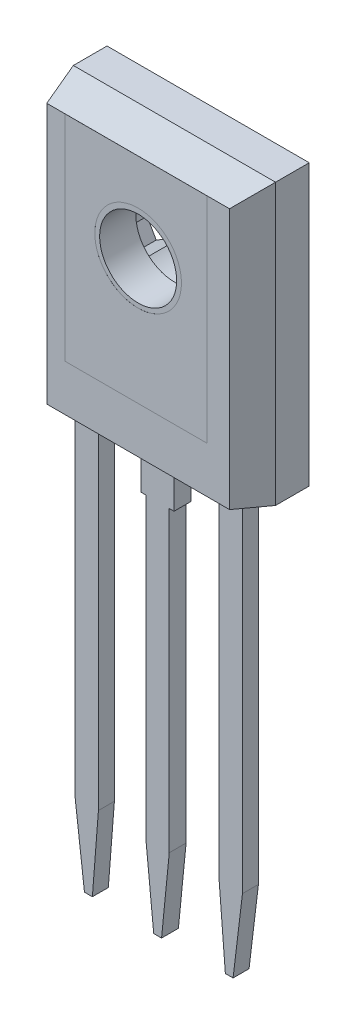
from build123d import *

# Parameters (mm, degrees)
SKETCH1_W                = 7.8
SKETCH1_H                = 10.8
SKETCH1_R                = 1.6
BOSS_EXTRUDE2_DEPTH      = 1.3
SKETCH3_W                = 7.8
SKETCH3_H                = 10.8
BOSS_EXTRUDE3_DEPTH      = 1.4
CUT_EXTRUDE2_DEPTH       = 2.5
CHAMFER2_SIZE            = 1.4
CHAMFER2_SIZE_2          = 0.375128869
SKETCH9_W                = 5.47205689
SKETCH9_H                = 8.265687236
BOSS_EXTRUDE7_DEPTH      = 0.001
SKETCH4_R                = 1.486166624
CUT_EXTRUDE3_DEPTH       = 4.4
BOSS_EXTRUDE4_DEPTH      = 1.5
BOSS_EXTRUDE4_DEPTH_BACK = 1.5
SKETCH5_W                = 1.27
SKETCH5_H                = 0.65
BOSS_EXTRUDE5_START      = -1.5
SKETCH7_W                = 0.9
SKETCH7_H                = 0.616281936
BOSS_EXTRUDE5_DEPTH      = 17.5
SKETCH10_R               = 1.671756862
CUT_EXTRUDE4_DEPTH       = 0.001
SKETCH12_W               = 0.9
SKETCH12_H               = 0.65
BOSS_EXTRUDE8_DEPTH      = 14.5
CUT_EXTRUDE6_DEPTH       = 15
CUT_EXTRUDE7_DEPTH       = 15
CUT_EXTRUDE8_DEPTH       = 15
SKETCH19_R               = 0.5
CUT_EXTRUDE10_DEPTH      = 0.1
CUT_EXTRUDE12_DEPTH      = 0.1
SKETCH21_W               = 0.230769231
SKETCH21_H               = 0.061538461
CUT_EXTRUDE13_DEPTH      = 0.1


with BuildPart() as part:
    # Sketch1 → Boss-Extrude2 (new body)
    with BuildSketch(Plane.XY):
        Rectangle(SKETCH1_W, SKETCH1_H)
        with Locations((0, 1.6)):
            Circle(SKETCH1_R, mode=Mode.SUBTRACT)
    extrude(amount=BOSS_EXTRUDE2_DEPTH)

    # Sketch2 → Cut-Extrude2 (cut)
    with BuildSketch(Plane.XY.offset(1.3)):
        Polygon((2.50166605, 0.733012702), (1.566244658, 1.273078494), (1.066244658, 0.40705309), (2.00166605, -0.133012702), (2.25166605, 0.3), align=None)
        Polygon((0, 4.2), (0.5, 4.2), (0.5, 3.119868415), (-0.5, 3.119868415), (-0.5, 4.2), align=None)
        Polygon((-2.00166605, -0.133012702), (-1.066244658, 0.40705309), (-1.566244658, 1.273078494), (-2.50166605, 0.733012702), (-2.25166605, 0.3), align=None)
    extrude(amount=-CUT_EXTRUDE2_DEPTH, mode=Mode.SUBTRACT)



with BuildPart() as body_2:
    # Sketch3 → Boss-Extrude3 (new body)
    with BuildSketch(Plane.XY.offset(1.3)):
        Rectangle(SKETCH3_W, SKETCH3_H)
    extrude(amount=BOSS_EXTRUDE3_DEPTH)

    # Chamfer2
    # the kernel refuses this chamfer: 1.4, 0.375128869 mm, written as the material it takes off along each edge
    with BuildSketch(Plane(origin=(7.535410198, 5.4, 2.7), x_dir=(0, 0.009967146577156156, -0.9999503267608394), z_dir=(-1, 0, 0)), Plane(origin=(-7.535410198, -5.4, 2.7), x_dir=(0, -0.009967146577156156, -0.9999503267608394), z_dir=(1, 0, 0))) as chamfer2_piece_1:
        Polygon((CHAMFER2_SIZE * 0.999950326761, CHAMFER2_SIZE * 0.00996714657716), (-CHAMFER2_SIZE_2 * 0.00996714658788, CHAMFER2_SIZE_2 * 0.999950327837), (0, 0), align=None)
    extrude(amount=15.070820397, mode=Mode.SUBTRACT)
    with BuildSketch(Plane(origin=(3.9, -9.035410198, 2.7), x_dir=(0.009967146577156461, 0, -0.9999503267608394), z_dir=(0, 1, 0)), Plane(origin=(-3.9, 9.035410198, 2.7), x_dir=(-0.009967146577156461, 0, -0.9999503267608394), z_dir=(0, -1, 0))) as chamfer2_piece_2:
        Polygon((CHAMFER2_SIZE * 0.999950326761, CHAMFER2_SIZE * 0.00996714657716), (-CHAMFER2_SIZE_2 * 0.00996714658788, CHAMFER2_SIZE_2 * 0.999950327837), (0, 0), align=None)
    extrude(amount=18.070820397, mode=Mode.SUBTRACT)

    # Sketch4 → Cut-Extrude3 (cut)
    with BuildSketch(Plane(origin=(0, 0, 1.3), x_dir=(-1, 0, 0), z_dir=(0, 0, -1))):
        with Locations((0, 1.6)):
            Circle(SKETCH4_R)
    extrude(amount=-CUT_EXTRUDE3_DEPTH, mode=Mode.SUBTRACT)


with BuildPart() as body_3:
    # Sketch9 → Boss-Extrude7 (new body)
    with BuildSketch(Plane.XY.offset(2.7)):
        with Locations((-0.07899218, 0.892027513)):
            Rectangle(SKETCH9_W, SKETCH9_H)
    extrude(amount=BOSS_EXTRUDE7_DEPTH)

    # Sketch10 → Cut-Extrude4 (cut)
    with BuildSketch(Plane.XY.offset(2.701)):
        with Locations((0, 1.615463385)):
            Circle(SKETCH10_R)
    extrude(amount=-CUT_EXTRUDE4_DEPTH, mode=Mode.SUBTRACT)


with BuildPart() as body_4:
    # Sketch5 → Boss-Extrude4 (new, two sides: drawn at the far end of the back side and taken through both)
    with BuildSketch(Plane.XZ.offset(5.4).offset(-BOSS_EXTRUDE4_DEPTH_BACK)):
        with Locations((0, 1.625)):
            Rectangle(SKETCH5_W, SKETCH5_H)
    extrude(amount=BOSS_EXTRUDE4_DEPTH + BOSS_EXTRUDE4_DEPTH_BACK)



with BuildPart() as part_1:
    add(part.part)

    add(body_2.part)  # Boss-Extrude5 merges body 2
    # Sketch7 → Boss-Extrude5 (add)
    with BuildSketch(Plane.XZ.offset(5.4).offset(BOSS_EXTRUDE5_START)):
        with Locations((-2.777989612, 1.596306683)):
            Rectangle(SKETCH7_W, SKETCH7_H)
    boss_extrude5 = extrude(amount=BOSS_EXTRUDE5_DEPTH)

    # Mirror1: Boss-Extrude5 across plane
    add(boss_extrude5.mirror(Plane(origin=(0, 0, 0), x_dir=(0, 0, 1), z_dir=(1, 0, 0))))


with BuildPart() as body_4_1:
    add(body_4.part)

    add(part_1.part)  # Boss-Extrude8 merges part
    # Sketch12 → Boss-Extrude8 (add)
    with BuildSketch(Plane.XZ.offset(6.9)):
        with Locations((0, 1.625)):
            Rectangle(SKETCH12_W, SKETCH12_H)
    extrude(amount=BOSS_EXTRUDE8_DEPTH)

    # Sketch13 → Cut-Extrude6 (cut)
    with BuildSketch(Plane.XY.offset(1.904447651)):
        Polygon((-2.327989612, -18.401297211), (-2.561302093, -21.4), (-2.327989612, -21.4), align=None)
        Polygon((-3.227989612, -21.4), (-2.865812834, -21.4), (-3.227989612, -18.401297211), align=None)
    extrude(amount=-CUT_EXTRUDE6_DEPTH, mode=Mode.SUBTRACT)

    # Sketch14 → Cut-Extrude7 (cut)
    with BuildSketch(Plane.XY.offset(1.95)):
        Polygon((0.45, -18.4), (0.15307153, -21.4), (0.45, -21.4), align=None)
        Polygon((-0.150188389, -21.4), (-0.45, -21.4), (-0.45, -18.4), align=None)
    extrude(amount=-CUT_EXTRUDE7_DEPTH, mode=Mode.SUBTRACT)

    # Sketch15 → Cut-Extrude8 (cut)
    with BuildSketch(Plane.XY.offset(1.904447651)):
        Polygon((2.569177225, -21.4), (2.327989612, -18.4), (2.327989612, -21.4), align=None)
        Polygon((3.227989612, -18.4), (2.865742943, -21.4), (3.227989612, -21.4), align=None)
    extrude(amount=-CUT_EXTRUDE8_DEPTH, mode=Mode.SUBTRACT)

    # Sketch19 → Cut-Extrude10 (cut)
    with BuildSketch(Plane(origin=(0, 0, 0), x_dir=(-1, 0, 0), z_dir=(0, 0, -1))):
        with Locations((2.415242459, 3.834109408)):
            Circle(SKETCH19_R)
        with Locations((-2.234159018, -1.213323665)):
            Circle(SKETCH19_R)
    extrude(amount=-CUT_EXTRUDE10_DEPTH, mode=Mode.SUBTRACT)

    # Sketch20 → Cut-Extrude12 (cut)
    # profile 1 of 2: a face of its own
    with BuildSketch(Plane(origin=(0, 0, 0), x_dir=(-1, 0, 0), z_dir=(0, 0, -1))):
        with BuildLine():
            Line((1.950403924, -2.501538497), (2.067471232, -2.501538497))
            add(Edge.make_bspline(
                [(2.067471232, -2.501538497), (2.073201828, -2.501568626), (2.08430915, -2.501627023), (2.100461054, -2.502532702), (2.115589422, -2.503767617), (2.12969864, -2.505727062), (2.142782189, -2.508091366), (2.154879498, -2.510954535), (2.165952099, -2.514387669), (2.179171425, -2.519847031), (2.194243539, -2.527959574), (2.210563263, -2.539947328), (2.224518276, -2.554610036), (2.236550216, -2.57114992), (2.246116122, -2.589344624), (2.253036573, -2.608760485), (2.257417923, -2.629147069), (2.257868512, -2.643143042), (2.258096232, -2.650216382)],
                knots=[0, 0, 0, 0, 1.001505555, 1.941167018, 2.826882275, 3.653841531, 4.429895133, 5.150066043, 5.825578002, 6.45369114, 7.647487171, 8.808567382, 9.977351308, 11.170798116, 12.373658725, 13.556498008, 14.765093433, 16, 16, 16, 16], degree=3))
            add(Edge.make_bspline(
                [(2.258096232, -2.650216382), (2.257908823, -2.656842534), (2.257540547, -2.669863549), (2.254018931, -2.688908253), (2.248505674, -2.707037033), (2.240841917, -2.724183728), (2.230881574, -2.739960919), (2.219077291, -2.754495879), (2.204835554, -2.767173203), (2.194165284, -2.774260558), (2.18874527, -2.777860613)],
                knots=[0, 0, 0, 0, 1.044552857, 2.05264487, 3.044412934, 4.028983338, 5.005914585, 5.980388656, 6.974128949, 8, 8, 8, 8], degree=3))
            add(Edge.make_bspline(
                [(2.18874527, -2.777860613), (2.195561344, -2.78047747), (2.20860218, -2.785484165), (2.226548354, -2.794335959), (2.242010327, -2.803963749), (2.255106981, -2.814477781), (2.266307722, -2.82581072), (2.276088226, -2.838128739), (2.284433605, -2.851592527), (2.291584391, -2.866061704), (2.297164178, -2.881388527), (2.301342905, -2.897429232), (2.303737324, -2.914126298), (2.304078063, -2.925489506), (2.304250078, -2.931225997)],
                knots=[0, 0, 0, 0, 1.27268992, 2.434971085, 3.483601985, 4.442670788, 5.356604649, 6.2567628, 7.179492994, 8.113709626, 9.066344395, 10.018646069, 10.999752585, 12, 12, 12, 12], degree=3))
            add(Edge.make_bspline(
                [(2.304250078, -2.931225997), (2.304082619, -2.937083175), (2.303753138, -2.948607337), (2.301322286, -2.965536789), (2.297206439, -2.981715351), (2.291537099, -2.997247668), (2.284137845, -3.012103691), (2.275133051, -3.026300251), (2.264396212, -3.039694708), (2.252385434, -3.0524359), (2.238797638, -3.063892092), (2.224137794, -3.074094785), (2.208221282, -3.082485538), (2.191309512, -3.089533999), (2.173212772, -3.09491809), (2.154012325, -3.098684817), (2.133724731, -3.101222824), (2.119803059, -3.101431487), (2.11266354, -3.101538497)],
                knots=[0, 0, 0, 0, 0.978564426, 1.925352924, 2.850884081, 3.763762016, 4.682927383, 5.618979971, 6.567305752, 7.547517671, 8.540179244, 9.531824382, 10.526200242, 11.540722885, 12.589160233, 13.674978461, 14.80764778, 16, 16, 16, 16], degree=3))
            Line((2.11266354, -3.101538497), (1.950403924, -3.101538497))
            Line((1.950403924, -3.101538497), (1.950403924, -2.501538497))
        make_face()
        with BuildLine():
            Line((2.004250078, -2.563076959), (2.004250078, -2.755384651))
            Line((2.004250078, -2.755384651), (2.040427963, -2.755384651))
            add(Edge.make_bspline(
                [(2.040427963, -2.755384651), (2.045716328, -2.755316093), (2.055934526, -2.755183624), (2.070732223, -2.754804164), (2.08446794, -2.753741643), (2.097117969, -2.752679426), (2.108662388, -2.750952354), (2.119075621, -2.748896562), (2.128521095, -2.746722349), (2.139413588, -2.743024723), (2.151768951, -2.737559979), (2.16494034, -2.729079092), (2.176551964, -2.718977775), (2.186357196, -2.707322181), (2.194382019, -2.694487978), (2.199955799, -2.680679941), (2.203735334, -2.666242205), (2.204076739, -2.656330504), (2.204250078, -2.651298113)],
                knots=[0, 0, 0, 0, 1.156816544, 2.235205308, 3.236616184, 4.169592532, 5.011045266, 5.787822928, 6.49130361, 7.128639758, 8.301311294, 9.436451833, 10.541879658, 11.654887649, 12.756523258, 13.837046038, 14.901820046, 16, 16, 16, 16], degree=3))
            add(Edge.make_bspline(
                [(2.204250078, -2.651298113), (2.204159876, -2.64796798), (2.203982934, -2.641435562), (2.202533796, -2.631912816), (2.200070784, -2.622956744), (2.196907191, -2.614444611), (2.192486273, -2.606642579), (2.187281107, -2.599280889), (2.180992132, -2.59261024), (2.173833735, -2.586375469), (2.165603686, -2.580847835), (2.156306893, -2.576006562), (2.145817577, -2.572108143), (2.134312516, -2.568693945), (2.121614615, -2.566295952), (2.107870406, -2.564298228), (2.092967311, -2.563281187), (2.082656722, -2.563146553), (2.077327001, -2.563076959)],
                knots=[0, 0, 0, 0, 0.91205012, 1.789085906, 2.630437955, 3.453916878, 4.269457761, 5.079663411, 5.91843418, 6.774407191, 7.675494373, 8.627863946, 9.638891023, 10.736472738, 11.911756761, 13.175263542, 14.539845004, 16, 16, 16, 16], degree=3))
            Line((2.077327001, -2.563076959), (2.004250078, -2.563076959))
        make_face(mode=Mode.SUBTRACT)
        with BuildLine():
            Line((2.004250078, -2.816923113), (2.004250078, -3.040000036))
            Line((2.004250078, -3.040000036), (2.08093277, -3.040000036))
            add(Edge.make_bspline(
                [(2.08093277, -3.040000036), (2.086421729, -3.03993425), (2.097000973, -3.039807458), (2.11227547, -3.039393534), (2.126432574, -3.038452001), (2.139407683, -3.036969856), (2.151340903, -3.035362122), (2.162089081, -3.033200188), (2.171739342, -3.030723223), (2.182929224, -3.026894508), (2.195529825, -3.020946541), (2.209108829, -3.011978388), (2.221181895, -3.001294393), (2.231434225, -2.988929093), (2.239836452, -2.975483723), (2.245948816, -2.961230234), (2.249718677, -2.946404144), (2.250175049, -2.936295565), (2.250403924, -2.931225997)],
                knots=[0, 0, 0, 0, 1.160039823, 2.235823828, 3.228722157, 4.157150951, 4.99529583, 5.772374946, 6.472645482, 7.099169577, 8.269452708, 9.405989375, 10.527446681, 11.663510218, 12.788923519, 13.866172445, 14.929861265, 16, 16, 16, 16], degree=3))
            add(Edge.make_bspline(
                [(2.250403924, -2.931225997), (2.250356592, -2.92805571), (2.250262691, -2.921766273), (2.248846586, -2.912523562), (2.246787065, -2.903570555), (2.244124534, -2.894882942), (2.240246911, -2.886617792), (2.235720075, -2.878611639), (2.230412406, -2.870853899), (2.222141977, -2.861046085), (2.210112494, -2.849746025), (2.193019904, -2.838682453), (2.173584653, -2.829759972), (2.159488511, -2.825971491), (2.152206809, -2.824014459)],
                knots=[0, 0, 0, 0, 0.723448775, 1.435228256, 2.130040452, 2.821711965, 3.505591119, 4.210454504, 4.921174351, 5.648778258, 7.137944449, 8.670945889, 10.280296675, 12, 12, 12, 12], degree=3))
            add(Edge.make_bspline(
                [(2.152206809, -2.824014459), (2.149287535, -2.823422159), (2.142957948, -2.82213793), (2.132636649, -2.820782324), (2.120853357, -2.819574599), (2.107580863, -2.818681258), (2.092802376, -2.81775785), (2.076486333, -2.817398738), (2.058699365, -2.816970294), (2.046357815, -2.816939242), (2.039947193, -2.816923113)],
                knots=[0, 0, 0, 0, 0.634451884, 1.375622551, 2.216452059, 3.157844607, 4.20941857, 5.370758133, 6.634282058, 8, 8, 8, 8], degree=3))
            Line((2.039947193, -2.816923113), (2.004250078, -2.816923113))
        make_face(mode=Mode.SUBTRACT)
    # profile 2 of 2: a face of its own
    with BuildSketch(Plane(origin=(0, 0, 0), x_dir=(-1, 0, 0), z_dir=(0, 0, -1))):
        with BuildLine():
            Line((2.427327001, -3.101538497), (2.427327001, -2.501538497))
            Line((2.427327001, -2.501538497), (2.548480847, -2.501538497))
            add(Edge.make_bspline(
                [(2.548480847, -2.501538497), (2.559018388, -2.501614366), (2.579376862, -2.501760945), (2.608796139, -2.502690327), (2.636016212, -2.504334406), (2.66094756, -2.506729182), (2.683658625, -2.509669702), (2.704085815, -2.513355486), (2.722334753, -2.517707744), (2.733558086, -2.521418392), (2.738865463, -2.523173113)],
                knots=[0, 0, 0, 0, 1.314313732, 2.53924729, 3.670748893, 4.714932338, 5.66265055, 6.526160246, 7.303039223, 8, 8, 8, 8], degree=3))
            add(Edge.make_bspline(
                [(2.738865463, -2.523173113), (2.745807418, -2.525818377), (2.759533908, -2.531048918), (2.779077986, -2.540915713), (2.79747662, -2.552095102), (2.814828473, -2.564601821), (2.830737186, -2.578789995), (2.845824254, -2.594056924), (2.859472493, -2.610957782), (2.871971058, -2.629142066), (2.883240028, -2.648395561), (2.893035312, -2.668681579), (2.901170283, -2.689897101), (2.907923407, -2.711983126), (2.913245657, -2.734988219), (2.916876845, -2.758939168), (2.919271872, -2.783741315), (2.919512567, -2.800571223), (2.919634693, -2.809110613)],
                knots=[0, 0, 0, 0, 0.984719456, 1.947108742, 2.898477687, 3.838006223, 4.779231079, 5.722358779, 6.681677486, 7.655904652, 8.64651281, 9.637519902, 10.640069247, 11.656948941, 12.698408672, 13.768548281, 14.867775369, 16, 16, 16, 16], degree=3))
            add(Edge.make_bspline(
                [(2.919634693, -2.809110613), (2.91952687, -2.816526825), (2.919314394, -2.831141246), (2.917406511, -2.852679685), (2.914633428, -2.873579155), (2.910340137, -2.893740132), (2.905128277, -2.913339255), (2.898448709, -2.93216764), (2.890796909, -2.950398007), (2.881874073, -2.96778386), (2.872078407, -2.984255295), (2.861566108, -2.999782529), (2.850348389, -3.014143995), (2.83831828, -3.027383186), (2.825631243, -3.039480142), (2.812204215, -3.050535916), (2.798002549, -3.060334183), (2.783089854, -3.069259973), (2.767031089, -3.077046319), (2.749522083, -3.083634321), (2.730488167, -3.089093741), (2.70997606, -3.093648751), (2.687950321, -3.097262003), (2.664389356, -3.099683671), (2.639329363, -3.101321316), (2.622121489, -3.101464698), (2.613264501, -3.101538497)],
                knots=[0, 0, 0, 0, 1.105936401, 2.179363191, 3.223086493, 4.248585256, 5.251745608, 6.245858792, 7.225916811, 8.198733463, 9.158002045, 10.082870192, 10.993790845, 11.873723703, 12.748670949, 13.606408763, 14.465103618, 15.319838547, 16.196477973, 17.123216899, 18.106603292, 19.147568657, 20.255746949, 21.433717677, 22.679120308, 24, 24, 24, 24], degree=3))
            Line((2.613264501, -3.101538497), (2.427327001, -3.101538497))
        make_face()
        with BuildLine():
            Line((2.481173155, -3.040000036), (2.550043347, -3.040000036))
            add(Edge.make_bspline(
                [(2.550043347, -3.040000036), (2.559939639, -3.039957505), (2.578973833, -3.039875703), (2.606343776, -3.039157896), (2.631351672, -3.037984993), (2.654001074, -3.036343551), (2.674279192, -3.034171788), (2.692228407, -3.031750376), (2.70778988, -3.028733671), (2.717206354, -3.02599922), (2.72155777, -3.024735613)],
                knots=[0, 0, 0, 0, 1.375205317, 2.645023457, 3.804390687, 4.853969522, 5.800190428, 6.637939096, 7.370582563, 8, 8, 8, 8], degree=3))
            add(Edge.make_bspline(
                [(2.72155777, -3.024735613), (2.727034632, -3.022806774), (2.737857542, -3.018995167), (2.753437156, -3.012042425), (2.767966929, -3.003806642), (2.781700076, -2.994651966), (2.794441788, -2.984255509), (2.806343065, -2.972843339), (2.817379946, -2.960357378), (2.827438398, -2.946813122), (2.836439822, -2.932294871), (2.84423489, -2.916945357), (2.851066581, -2.900932761), (2.856428625, -2.884011191), (2.860631297, -2.866331923), (2.863608101, -2.847893715), (2.865462053, -2.82870001), (2.865678302, -2.81564536), (2.86578854, -2.80899042)],
                knots=[0, 0, 0, 0, 0.998632004, 1.973411704, 2.929992603, 3.868527914, 4.809262121, 5.754881198, 6.702106254, 7.672490631, 8.653608572, 9.636854334, 10.631411391, 11.644891563, 12.686317036, 13.754757253, 14.855430412, 16, 16, 16, 16], degree=3))
            add(Edge.make_bspline(
                [(2.86578854, -2.80899042), (2.865700548, -2.801973252), (2.865527686, -2.788187964), (2.863354947, -2.767960987), (2.860179823, -2.748507161), (2.855588334, -2.729825185), (2.849737327, -2.71187861), (2.842435388, -2.694766694), (2.834092539, -2.678308717), (2.824166253, -2.66288454), (2.813295008, -2.64829715), (2.801230229, -2.63493345), (2.788163594, -2.622762998), (2.774237619, -2.611596259), (2.759059831, -2.601882486), (2.74298777, -2.593193341), (2.725785655, -2.585819188), (2.713817764, -2.581897097), (2.707735655, -2.579903882)],
                knots=[0, 0, 0, 0, 1.122418816, 2.205001699, 3.251619955, 4.274784885, 5.280384055, 6.268708349, 7.249350384, 8.229342522, 9.199999885, 10.157847722, 11.105861043, 12.055065948, 13.010012805, 13.98527497, 14.976112212, 16, 16, 16, 16], degree=3))
            add(Edge.make_bspline(
                [(2.707735655, -2.579903882), (2.70270403, -2.578512494), (2.692005414, -2.575554022), (2.674547221, -2.572326816), (2.654898909, -2.56948033), (2.632973246, -2.567070381), (2.608795225, -2.565341125), (2.58234625, -2.564043186), (2.553614889, -2.563167763), (2.533697883, -2.563107985), (2.523360655, -2.563076959)],
                knots=[0, 0, 0, 0, 0.674548936, 1.434276114, 2.292660221, 3.240891867, 4.284742987, 5.42552168, 6.663806718, 8, 8, 8, 8], degree=3))
            Line((2.523360655, -2.563076959), (2.481173155, -2.563076959))
            Line((2.481173155, -2.563076959), (2.481173155, -3.040000036))
        make_face(mode=Mode.SUBTRACT)
    extrude(amount=-CUT_EXTRUDE12_DEPTH, mode=Mode.SUBTRACT)

    # Sketch21 → Cut-Extrude13 (cut)
    # profile 1 of 6: a face of its own
    with BuildSketch(Plane(origin=(0, 0, 0), x_dir=(-1, 0, 0), z_dir=(0, 0, -1))):
        Polygon((-0.025656151, -3.428685515), (0.085281349, -3.428685515), (0.085281349, -4.028685515), (0.031435195, -4.028685515), (0.031435195, -3.490223977), (-0.060872497, -3.490223977), align=None)
    # profile 2 of 6: a face of its own
    with BuildSketch(Plane(origin=(0, 0, 0), x_dir=(-1, 0, 0), z_dir=(0, 0, -1))):
        Polygon((0.635882311, -3.4133009), (0.646819811, -3.4133009), (0.646819811, -3.828685515), (0.71605058, -3.828685515), (0.71605058, -3.890223977), (0.646819811, -3.890223977), (0.646819811, -4.028685515), (0.592973657, -4.028685515), (0.592973657, -3.890223977), (0.308358272, -3.890223977), align=None)
        Polygon((0.592973657, -3.828685515), (0.592973657, -3.568108592), (0.414127503, -3.828685515), align=None, mode=Mode.SUBTRACT)
    # profile 3 of 6: a face of its own
    with BuildSketch(Plane(origin=(0, 0, 0), x_dir=(-1, 0, 0), z_dir=(0, 0, -1))):
        with BuildLine():
            add(Edge.make_bspline(
                [(0.769896734, -3.7289259), (0.769952965, -3.719309205), (0.770062196, -3.700628636), (0.771277354, -3.673408412), (0.773295984, -3.647872362), (0.776062391, -3.624019265), (0.779428902, -3.601842963), (0.783922985, -3.581402718), (0.789033752, -3.562603929), (0.794957028, -3.545385292), (0.801640649, -3.529514829), (0.808915094, -3.51469908), (0.817069058, -3.500960463), (0.825636529, -3.488079699), (0.834964313, -3.476267637), (0.844786963, -3.465357466), (0.855487856, -3.455601337), (0.866703229, -3.4467134), (0.878534622, -3.438922062), (0.890644794, -3.432059307), (0.903117098, -3.426196472), (0.915985586, -3.421586683), (0.929134596, -3.417779109), (0.942610093, -3.41517529), (0.956434327, -3.413536963), (0.96576543, -3.413380334), (0.970497695, -3.4133009)],
                knots=[0, 0, 0, 0, 1.646270934, 3.197905019, 4.663502075, 6.030701355, 7.308322542, 8.50163776, 9.611534131, 10.641858119, 11.616356847, 12.558055219, 13.465016945, 14.349605745, 15.204443733, 16.039544428, 16.859896111, 17.680448484, 18.487036065, 19.28249412, 20.06191084, 20.843045899, 21.620316918, 22.403196591, 23.190181807, 24, 24, 24, 24], degree=3))
            add(Edge.make_bspline(
                [(0.970497695, -3.4133009), (0.975269492, -3.413384525), (0.984759093, -3.41355083), (0.998788872, -3.41514922), (1.012494531, -3.417801413), (1.025817641, -3.421559294), (1.038867639, -3.42622141), (1.051542451, -3.432064916), (1.063920808, -3.438867007), (1.075806, -3.446859672), (1.087328506, -3.455770919), (1.098205299, -3.46584452), (1.108437371, -3.476978757), (1.118153138, -3.489054505), (1.127076955, -3.502303377), (1.135575257, -3.516494939), (1.143181892, -3.531877373), (1.150507836, -3.548194024), (1.15683132, -3.565896366), (1.162534105, -3.584884611), (1.167141928, -3.605383043), (1.170980089, -3.627284113), (1.1739535, -3.650668253), (1.176119095, -3.675485336), (1.177263053, -3.701751688), (1.177478487, -3.719710177), (1.177589041, -3.7289259)],
                knots=[0, 0, 0, 0, 0.810914788, 1.612654377, 2.396697861, 3.181598691, 3.963628158, 4.749916497, 5.551656086, 6.361998678, 7.18212741, 8.025565596, 8.878627764, 9.750805457, 10.657531673, 11.591944965, 12.560506719, 13.57287815, 14.630710178, 15.753379473, 16.941251878, 18.199788006, 19.531962791, 20.947069417, 22.433333509, 24, 24, 24, 24], degree=3))
            add(Edge.make_bspline(
                [(1.177589041, -3.7289259), (1.177477341, -3.738101427), (1.177259698, -3.755979567), (1.17613192, -3.782127734), (1.17391044, -3.806813113), (1.171131585, -3.830094907), (1.167282848, -3.851876213), (1.162550534, -3.872232404), (1.157296193, -3.891251388), (1.150810228, -3.908777355), (1.143711249, -3.925054794), (1.135987502, -3.940254876), (1.127712674, -3.954511955), (1.118697461, -3.967711912), (1.109088304, -3.979948253), (1.09867954, -3.991004988), (1.087764583, -4.001148532), (1.076208169, -4.010174525), (1.064137617, -4.018074777), (1.051801775, -4.025140009), (1.038981767, -4.030837042), (1.025968118, -4.035728764), (1.012574684, -4.039465984), (0.99881816, -4.042050073), (0.984768519, -4.04386239), (0.975271108, -4.044000644), (0.970497695, -4.044070131)],
                knots=[0, 0, 0, 0, 1.561518951, 3.042555995, 4.452378317, 5.7783523, 7.031515105, 8.214008947, 9.334062868, 10.386615937, 11.391082383, 12.354592575, 13.286541444, 14.194233754, 15.072674879, 15.931287219, 16.775624067, 17.606195743, 18.42308326, 19.229000347, 20.022332153, 20.807536673, 21.593273796, 22.3848459, 23.188221202, 24, 24, 24, 24], degree=3))
            add(Edge.make_bspline(
                [(0.970497695, -4.044070131), (0.965765561, -4.043990184), (0.956434717, -4.043832545), (0.942608587, -4.042201619), (0.92918874, -4.039579533), (0.916108953, -4.035908115), (0.903302122, -4.031414143), (0.890942759, -4.025559226), (0.878893441, -4.018816243), (0.867186318, -4.011137028), (0.856041376, -4.002339025), (0.845395901, -3.992608004), (0.835517326, -3.981701133), (0.826322909, -3.969790632), (0.817584494, -3.956986077), (0.809546316, -3.943112641), (0.802111312, -3.928225336), (0.795315285, -3.91222798), (0.7892898, -3.894887136), (0.783967336, -3.876004419), (0.779764909, -3.855413167), (0.776167831, -3.833278762), (0.773266508, -3.809506088), (0.771285767, -3.78408224), (0.770061541, -3.757023061), (0.769952672, -3.738462529), (0.769896734, -3.7289259)],
                knots=[0, 0, 0, 0, 0.810891512, 1.598919785, 2.382837074, 3.152667961, 3.926044502, 4.706494248, 5.493654104, 6.291793342, 7.103789334, 7.925228297, 8.761435821, 9.622817696, 10.50288917, 11.416980706, 12.369136599, 13.353924996, 14.394355917, 15.514179734, 16.714354668, 17.994756427, 19.357759367, 20.818452758, 22.365282078, 24, 24, 24, 24], degree=3))
        make_face()
        with BuildLine():
            add(Edge.make_bspline(
                [(0.823742888, -3.728685515), (0.823763364, -3.736699578), (0.823803105, -3.7522533), (0.824841311, -3.774855002), (0.826255637, -3.795935629), (0.828079859, -3.81552195), (0.830788936, -3.833547666), (0.833824385, -3.850136755), (0.837518343, -3.865201424), (0.841888918, -3.878845049), (0.846867049, -3.891299175), (0.85230234, -3.902887955), (0.858141321, -3.913748287), (0.864676032, -3.923782619), (0.8717929, -3.933023676), (0.879331173, -3.941635019), (0.887572188, -3.949314501), (0.898972829, -3.958524819), (0.914023654, -3.968042385), (0.93298716, -3.976330286), (0.95247318, -3.981538707), (0.965699109, -3.982201065), (0.97230058, -3.982531669)],
                knots=[0, 0, 0, 0, 1.459021318, 2.831673884, 4.118529203, 5.306027144, 6.411944654, 7.436330062, 8.375795394, 9.233974572, 10.042671642, 10.816086306, 11.563610507, 12.285937304, 12.993564865, 13.685989202, 14.367179055, 15.041617293, 16.353048772, 17.594441528, 18.799311195, 20, 20, 20, 20], degree=3))
            add(Edge.make_bspline(
                [(0.97230058, -3.982531669), (0.978944752, -3.982257764), (0.992219379, -3.981710519), (1.011613744, -3.976430735), (1.03044179, -3.968464528), (1.04519698, -3.959044956), (1.056422559, -3.950074385), (1.064465471, -3.94242616), (1.071847537, -3.933862297), (1.078849035, -3.924622418), (1.085270591, -3.914529992), (1.091109986, -3.90363355), (1.09643856, -3.891902834), (1.099474397, -3.883713736), (1.101026541, -3.879526861)],
                knots=[0, 0, 0, 0, 1.353760809, 2.704726607, 4.075137775, 5.516104923, 6.260822281, 7.007110065, 7.778089737, 8.566572457, 9.372053459, 10.217411131, 11.088608312, 12, 12, 12, 12], degree=3))
            add(Edge.make_bspline(
                [(1.101026541, -3.879526861), (1.102835416, -3.874173192), (1.106508207, -3.863302946), (1.111241654, -3.846440606), (1.114969437, -3.828748704), (1.118323156, -3.810332969), (1.120612252, -3.791057592), (1.122454734, -3.770982212), (1.123539995, -3.750091693), (1.123674523, -3.735898266), (1.123742888, -3.728685515)],
                knots=[0, 0, 0, 0, 0.884706709, 1.796334032, 2.740027952, 3.714592787, 4.726048262, 5.777819803, 6.87074269, 8, 8, 8, 8], degree=3))
            add(Edge.make_bspline(
                [(1.123742888, -3.728685515), (1.123648569, -3.721473931), (1.123464063, -3.707366532), (1.122758808, -3.686706272), (1.120937624, -3.667083227), (1.118914918, -3.648412861), (1.115932537, -3.630798523), (1.112716913, -3.614092756), (1.108396705, -3.598502524), (1.103781886, -3.583783738), (1.098500104, -3.570103626), (1.092685978, -3.557398405), (1.086476534, -3.545606738), (1.07973215, -3.534760977), (1.07253289, -3.524812541), (1.064688739, -3.515960896), (1.056510846, -3.507931702), (1.045056472, -3.49876669), (1.030060879, -3.489421828), (1.011401625, -3.480821983), (0.991983801, -3.475883419), (0.978856923, -3.475187129), (0.97230058, -3.474839361)],
                knots=[0, 0, 0, 0, 1.31362396, 2.569729283, 3.763502607, 4.902122613, 5.988968491, 7.01645872, 7.998833611, 8.933434873, 9.825090667, 10.667526885, 11.477055099, 12.250526234, 12.991942729, 13.710640831, 14.402115721, 15.076753259, 16.378508321, 17.609869233, 18.806226677, 20, 20, 20, 20], degree=3))
            add(Edge.make_bspline(
                [(0.97230058, -3.474839361), (0.965664478, -3.475187609), (0.952380186, -3.47588474), (0.932760537, -3.480803583), (0.913954076, -3.489377234), (0.898998138, -3.498797641), (0.887535774, -3.507769923), (0.879464456, -3.515550458), (0.87189654, -3.524061245), (0.864924935, -3.533387287), (0.858395343, -3.543409922), (0.852398598, -3.554207995), (0.846995627, -3.565836229), (0.842009707, -3.578284761), (0.8376258, -3.591927209), (0.834009692, -3.606973322), (0.830669055, -3.623509646), (0.828304151, -3.64163299), (0.826201793, -3.661224217), (0.824850705, -3.682357471), (0.823799632, -3.704997079), (0.823762181, -3.720631221), (0.823742888, -3.728685515)],
                knots=[0, 0, 0, 0, 1.207732386, 2.417664972, 3.655092373, 4.956220595, 5.625982001, 6.301752483, 6.994047911, 7.697131622, 8.419323945, 9.170223765, 9.943494443, 10.752040957, 11.610060368, 12.549350801, 13.567764191, 14.679664412, 15.874934091, 17.154273443, 18.533957287, 20, 20, 20, 20], degree=3))
        make_face(mode=Mode.SUBTRACT)
    # profile 4 of 6: a face of its own
    with BuildSketch(Plane(origin=(0, 0, 0), x_dir=(-1, 0, 0), z_dir=(0, 0, -1))):
        with Locations((1.577589042, -3.797916285)):
            Rectangle(SKETCH21_W, SKETCH21_H)
    # profile 5 of 6: a face of its own
    with BuildSketch(Plane(origin=(0, 0, 0), x_dir=(-1, 0, 0), z_dir=(0, 0, -1))):
        Polygon((2.097420772, -3.428685515), (2.208358272, -3.428685515), (2.208358272, -4.028685515), (2.154512118, -4.028685515), (2.154512118, -3.490223977), (2.062204426, -3.490223977), align=None)
    # profile 6 of 6: a face of its own
    with BuildSketch(Plane(origin=(0, 0, 0), x_dir=(-1, 0, 0), z_dir=(0, 0, -1))):
        with BuildLine():
            Line((2.708358272, -3.4133009), (2.749824618, -3.445873015))
            Line((2.749824618, -3.445873015), (2.591290965, -3.6883009))
            add(Edge.make_bspline(
                [(2.591290965, -3.6883009), (2.601845869, -3.686618524), (2.622434404, -3.683336859), (2.643274272, -3.682795497), (2.653430388, -3.682531669)],
                knots=[0, 0, 0, 0, 1.025318673, 2, 2, 2, 2], degree=3))
            add(Edge.make_bspline(
                [(2.653430388, -3.682531669), (2.65952853, -3.682695574), (2.671532541, -3.683018216), (2.689156565, -3.685501162), (2.706091811, -3.689414038), (2.722268087, -3.695117853), (2.737743455, -3.702403971), (2.752606723, -3.711136349), (2.766578496, -3.721765894), (2.779838699, -3.733639886), (2.79187763, -3.746791369), (2.802536382, -3.760745884), (2.811489546, -3.775488893), (2.818753647, -3.791012927), (2.824394483, -3.807294057), (2.828506651, -3.824311452), (2.830937439, -3.842076847), (2.831267523, -3.85415882), (2.831435195, -3.860296092)],
                knots=[0, 0, 0, 0, 1.04369286, 2.054478336, 3.041073146, 4.015093852, 4.984733326, 5.965804835, 6.960378782, 7.985147595, 9.009457201, 10.008161701, 10.986880575, 11.956520048, 12.937015923, 13.931873656, 14.949455224, 16, 16, 16, 16], degree=3))
            add(Edge.make_bspline(
                [(2.831435195, -3.860296092), (2.831191234, -3.868692613), (2.830711177, -3.885214978), (2.825927669, -3.909279557), (2.818494587, -3.932205131), (2.807869868, -3.953625674), (2.794672888, -3.973511829), (2.778579587, -3.991132195), (2.760160703, -4.006847058), (2.739334395, -4.019988193), (2.716921315, -4.030720144), (2.693375258, -4.038428472), (2.668924891, -4.043174209), (2.652329815, -4.04376917), (2.643935195, -4.044070131)],
                knots=[0, 0, 0, 0, 1.031375318, 2.029502543, 3.004789286, 3.987476834, 4.960371455, 5.9300674, 6.912260825, 7.929083631, 8.949397511, 9.960523116, 10.96833055, 12, 12, 12, 12], degree=3))
            add(Edge.make_bspline(
                [(2.643935195, -4.044070131), (2.635861475, -4.043808152), (2.619868849, -4.04328922), (2.596343227, -4.038666487), (2.573738139, -4.031173841), (2.552211959, -4.020851393), (2.532271283, -4.007812899), (2.514431459, -3.992116509), (2.498781441, -3.974097743), (2.48575722, -3.953759398), (2.475427152, -3.931903977), (2.467680307, -3.90911475), (2.463155237, -3.885474753), (2.462522913, -3.869449415), (2.462204426, -3.861377823)],
                knots=[0, 0, 0, 0, 1.012016664, 2.004627821, 2.994792927, 3.992885782, 4.990978636, 5.973936114, 6.964471063, 7.975201453, 8.993600317, 9.990122807, 10.98767138, 12, 12, 12, 12], degree=3))
            add(Edge.make_bspline(
                [(2.462204426, -3.861377823), (2.462406959, -3.855198751), (2.462820494, -3.842582268), (2.465707932, -3.823474149), (2.470347611, -3.803922535), (2.475543654, -3.787336102), (2.481033758, -3.773748412), (2.485602765, -3.762793528), (2.491289736, -3.751520202), (2.497353744, -3.739541864), (2.504340636, -3.727167218), (2.511937604, -3.714189446), (2.520354687, -3.700814945), (2.526255287, -3.691738797), (2.529271734, -3.687098977)],
                knots=[0, 0, 0, 0, 1.173818275, 2.396712641, 3.66331629, 4.989737886, 5.693666774, 6.447286557, 7.243889047, 8.091586357, 8.998013824, 9.943181721, 10.948533338, 12, 12, 12, 12], degree=3))
            Line((2.529271734, -3.687098977), (2.708358272, -3.4133009))
        make_face()
        with BuildLine():
            add(Edge.make_bspline(
                [(2.642132311, -3.744070131), (2.63756164, -3.744203509), (2.628633793, -3.744464037), (2.615535379, -3.745976938), (2.603138821, -3.74882592), (2.591279884, -3.752454434), (2.580180278, -3.75744353), (2.569759334, -3.763503839), (2.559976754, -3.770638898), (2.550935002, -3.778747625), (2.542737345, -3.787625574), (2.535677723, -3.797134635), (2.529588169, -3.807045641), (2.524637, -3.817441403), (2.520781558, -3.828317945), (2.517992715, -3.839625245), (2.516440644, -3.851439126), (2.516182432, -3.859450412), (2.51605058, -3.863541284)],
                knots=[0, 0, 0, 0, 1.129588631, 2.206414736, 3.251139165, 4.268635594, 5.265702196, 6.250456724, 7.242448911, 8.251968645, 9.246821453, 10.222880186, 11.173611482, 12.116736599, 13.062300278, 14.020270554, 14.989073742, 16, 16, 16, 16], degree=3))
            add(Edge.make_bspline(
                [(2.51605058, -3.863541284), (2.516157956, -3.867595567), (2.516368505, -3.875545411), (2.518280331, -3.887260699), (2.521200631, -3.898534683), (2.525544699, -3.909309243), (2.530726451, -3.919748611), (2.537567364, -3.92947466), (2.545147384, -3.939078101), (2.554208059, -3.94782121), (2.563932064, -3.955956632), (2.574320841, -3.963067532), (2.585148263, -3.969150876), (2.596560507, -3.973918493), (2.608395658, -3.977831228), (2.620752325, -3.980584624), (2.6336391, -3.982141286), (2.642368575, -3.982399833), (2.646819811, -3.982531669)],
                knots=[0, 0, 0, 0, 0.989467248, 1.94019797, 2.891935182, 3.827694429, 4.772920941, 5.730924762, 6.725747692, 7.756678648, 8.79901574, 9.819492441, 10.826891316, 11.826466727, 12.835195252, 13.867842842, 14.912794438, 16, 16, 16, 16], degree=3))
            add(Edge.make_bspline(
                [(2.646819811, -3.982531669), (2.651271039, -3.982399823), (2.6600005, -3.982141255), (2.672887379, -3.980584741), (2.685243662, -3.977830801), (2.697080206, -3.97392004), (2.708487309, -3.969145136), (2.719305261, -3.963105378), (2.729595791, -3.955912901), (2.73932618, -3.947835113), (2.748349141, -3.939028339), (2.75611096, -3.929560386), (2.762742371, -3.919670004), (2.768131089, -3.909350366), (2.77242731, -3.898528168), (2.775362419, -3.887262444), (2.777270297, -3.875544954), (2.777481389, -3.867595412), (2.777589041, -3.863541284)],
                knots=[0, 0, 0, 0, 1.087397944, 2.132534446, 3.165364764, 4.174271784, 5.174024072, 6.181601208, 7.194203697, 8.236725232, 9.267838612, 10.269026844, 11.221737037, 12.171628256, 13.107553087, 14.05945871, 15.010357665, 16, 16, 16, 16], degree=3))
            add(Edge.make_bspline(
                [(2.777589041, -3.863541284), (2.777494705, -3.859445076), (2.777309555, -3.85140555), (2.775215392, -3.83963053), (2.772310985, -3.828260494), (2.767925323, -3.817366903), (2.762227629, -3.806992744), (2.755287617, -3.797085613), (2.747259176, -3.787569553), (2.737985312, -3.778730215), (2.727889843, -3.770647858), (2.717155743, -3.763513077), (2.705925805, -3.757491653), (2.694211415, -3.752467578), (2.681878349, -3.748841954), (2.669125719, -3.745987112), (2.655790421, -3.744467909), (2.646743002, -3.744204412), (2.642132311, -3.744070131)],
                knots=[0, 0, 0, 0, 0.978206639, 1.919901502, 2.851605144, 3.780102724, 4.718870031, 5.675451981, 6.667674623, 7.690630536, 8.733308323, 9.756129687, 10.767539656, 11.776269907, 12.797430371, 13.836405707, 14.897401972, 16, 16, 16, 16], degree=3))
        make_face(mode=Mode.SUBTRACT)
    extrude(amount=-CUT_EXTRUDE13_DEPTH, mode=Mode.SUBTRACT)


solid = Compound([body_3.part, body_4_1.part])
